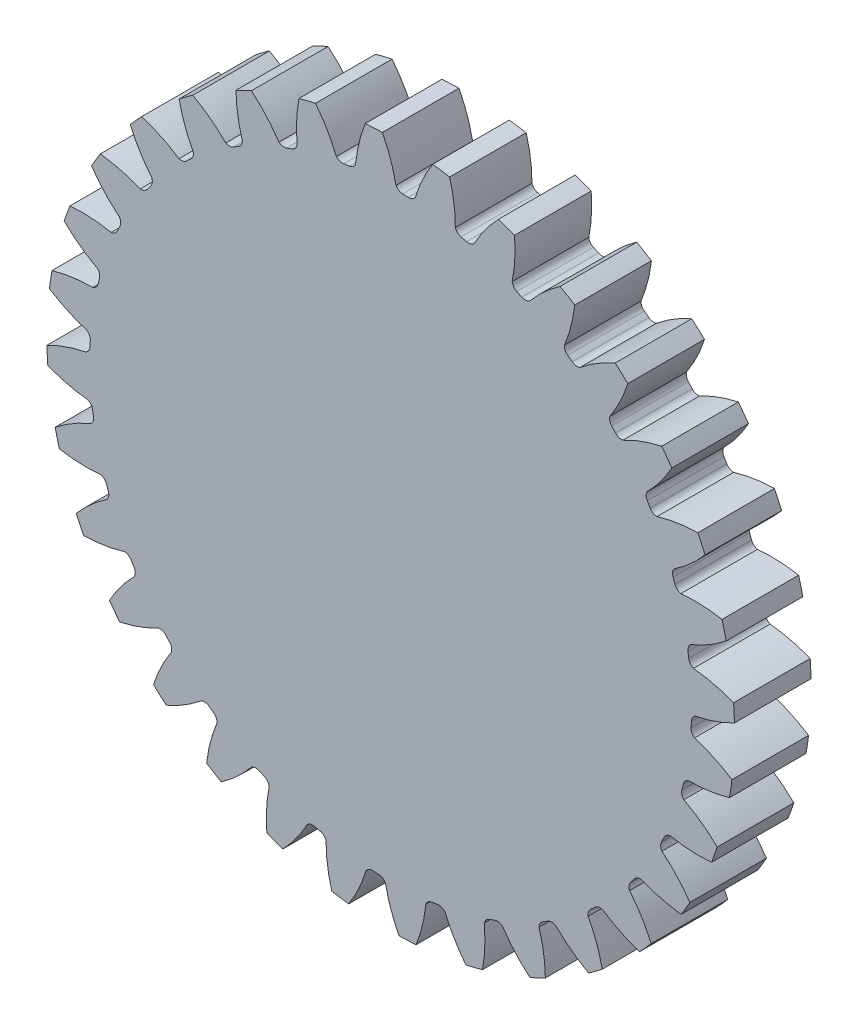
from build123d import *

# Parameters (mm, degrees)
SKETCH1_R                = 13.462
BOSS_EXTRUDE1_DEPTH      = 3
CUT_EXTRUDE1_DEPTH       = 20.2730612
FILLET1_R                = 0.311705625
CIRPATTERN1_COUNT        = 32
FILLET1_OF_CIRPATTERN1_R = 0.311705625


with BuildPart() as part:
    # Sketch1 → Boss-Extrude1 (new body)
    with BuildSketch(Plane.XY):
        Circle(SKETCH1_R)
    extrude(amount=-BOSS_EXTRUDE1_DEPTH)

    # Sketch4 → Cut-Extrude1 (cut, through all)
    with BuildSketch(Plane.XY):
        with BuildLine():
            Line((0.207454587, 11.93229302), (0.207454587, 11.779804646))
            ThreePointArc((0.207454587, 11.779804646), (0.578098596, 11.767439693), (0.948169824, 11.743415555))
            Line((0.948169824, 11.743415555), (0.963116334, 11.895169652))
            add(Edge.make_bspline(
                [(3.306374017, 15.066734335), (1.541843414, 13.803784653), (0.963116334, 11.895169652)],
                knots=[0, 0, 0, 1, 1, 1], degree=2))
            ThreePointArc((3.306374017, 15.066734335), (0.756883318, 15.406677783), (-1.813651192, 15.318265633))
            add(Edge.make_bspline(
                [(-1.813651192, 15.318265633), (-0.181408331, 13.888442781), (0.207454587, 11.93229302)],
                knots=[0, 0, 0, 1, 1, 1], degree=2))
        make_face()
    cut_extrude1 = extrude(amount=-CUT_EXTRUDE1_DEPTH, mode=Mode.SUBTRACT)

    # Fillet1
    # the kernel refuses this fillet: 0.311705625 mm, written as the material it adds along each edge
    with BuildSketch(Plane(origin=(0.948169824, 11.743415555, 0), x_dir=(0.09801736879934149, 0.995184704169861, 0), z_dir=(0, 0, -1))) as fillet1_piece_1:
        with BuildLine():
            CenterArc((0.304008317, -0.27240063), FILLET1_R, 119.084532855, 58.641413368)
            Line((-0.007451829, -0.260032367), (-0.013681032, -0.259785002))
            ThreePointArc((-0.013681032, -0.259785002), (-0.009239756, -0.129858172), (-0.006233146, 0.000109772))
            Line((-0.006233146, 0.000109772), (0, 0.006234113))
            ThreePointArc((0, 0.006234113), (0.076244187, 0.006234113), (0.149457975, 0.005448013))
            Line((0.149457975, 0.005448013), (0.152488373, 0))
        make_face()
    extrude(amount=3)
    with BuildSketch(Plane(origin=(0.207454587, 11.779804646, 0), x_dir=(0.9995896319554183, -0.028645552660602168, 0), z_dir=(0, 0, -1))) as fillet1_piece_2:
        with BuildLine():
            CenterArc((0.263580359, -0.311686629), FILLET1_R, 90.632559963, 58.641413368)
            Line((-0.004368114, -0.152425797), (-0.009727083, -0.14924058))
            ThreePointArc((-0.009727083, -0.14924058), (-0.008415611, -0.076034319), (-0.006231554, 0.00017858))
            Line((-0.006231554, 0.00017858), (6.8825e-05, 0.006233733))
            ThreePointArc((6.8825e-05, 0.006233733), (0.13006956, 0.005516105), (0.260070295, 0.006233733))
            Line((0.260070295, 0.006233733), (0.26013912, 0))
        make_face()
    extrude(amount=3)

    # CirPattern1: Cut-Extrude1 ×32 about axis
    cirpattern1_axis = Axis((0, 0, -3), (0, 0, 1))
    for i in range(1, CIRPATTERN1_COUNT):
        add(cut_extrude1.rotate(cirpattern1_axis, i * 360 / CIRPATTERN1_COUNT), mode=Mode.SUBTRACT)

    # Fillet1 of CirPattern1
    # the kernel refuses this fillet: 0.311705625 mm, written as the material it adds along each edge
    with BuildSketch(Plane(origin=(-1.361075715, 11.702747874, 0), x_dir=(-0.9919686085446638, -0.1264843059907568, 0), z_dir=(0, 0, -1)), Plane(origin=(-3.618015878, 11.212350156, 0), x_dir=(-0.948232345896958, -0.31757742078861934, 0), z_dir=(0, 0, -1)), Plane(origin=(-5.73591772, 10.291068109, 0), x_dir=(-0.8680560459712611, -0.49646621340504116, 0), z_dir=(0, 0, -1)), Plane(origin=(-7.633391461, 8.974306086, 0), x_dir=(-0.754520839010323, -0.6562760878617767, 0), z_dir=(0, 0, -1)), Plane(origin=(-9.237518248, 7.312666513, 0), x_dir=(-0.6119898193463794, -0.7908656403058524, 0), z_dir=(0, 0, -1)), Plane(origin=(-10.48665239, 5.370005266, 0), x_dir=(-0.44594037413280585, -0.8950626697155306, 0), z_dir=(0, 0, -1)), Plane(origin=(-11.332790362, 3.220977729, 0), x_dir=(-0.26275369042754343, -0.9648629426849735, 0), z_dir=(0, 0, -1)), Plane(origin=(-11.743415555, 0.948169824, 0), x_dir=(-0.06946952975312047, -0.9975840738684034, 0), z_dir=(0, 0, -1)), Plane(origin=(-11.702747874, -1.361075715, 0), x_dir=(0.1264843059907568, -0.9919686085446638, 0), z_dir=(0, 0, -1)), Plane(origin=(-11.212350156, -3.618015878, 0), x_dir=(0.31757742078862394, -0.9482323458969565, 0), z_dir=(0, 0, -1)), Plane(origin=(-10.291068109, -5.73591772, 0), x_dir=(0.49646621340504776, -0.8680560459712573, 0), z_dir=(0, 0, -1)), Plane(origin=(-8.974306086, -7.633391461, 0), x_dir=(0.6562760878617767, -0.754520839010323, 0), z_dir=(0, 0, -1)), Plane(origin=(-7.312666513, -9.237518248, 0), x_dir=(0.7908656403058557, -0.6119898193463752, 0), z_dir=(0, 0, -1)), Plane(origin=(-5.370005266, -10.48665239, 0), x_dir=(0.8950626697155298, -0.4459403741328072, 0), z_dir=(0, 0, -1)), Plane(origin=(-3.220977729, -11.332790362, 0), x_dir=(0.9648629426849732, -0.26275369042754426, 0), z_dir=(0, 0, -1)), Plane(origin=(-0.948169824, -11.743415555, 0), x_dir=(0.9975840738684034, -0.06946952975312047, 0), z_dir=(0, 0, -1)), Plane(origin=(1.361075715, -11.702747874, 0), x_dir=(0.9919686085446638, 0.12648430599075672, 0), z_dir=(0, 0, -1)), Plane(origin=(3.618015878, -11.212350156, 0), x_dir=(0.9482323458969549, 0.317577420788628, 0), z_dir=(0, 0, -1)), Plane(origin=(5.73591772, -10.291068109, 0), x_dir=(0.8680560459712532, 0.49646621340505515, 0), z_dir=(0, 0, -1)), Plane(origin=(7.633391461, -8.974306086, 0), x_dir=(0.754520839010323, 0.6562760878617767, 0), z_dir=(0, 0, -1)), Plane(origin=(9.237518248, -7.312666513, 0), x_dir=(0.6119898193463794, 0.7908656403058524, 0), z_dir=(0, 0, -1)), Plane(origin=(10.48665239, -5.370005266, 0), x_dir=(0.44594037413279225, 0.8950626697155375, 0), z_dir=(0, 0, -1)), Plane(origin=(11.332790362, -3.220977729, 0), x_dir=(0.26275369042753616, 0.9648629426849755, 0), z_dir=(0, 0, -1)), Plane(origin=(11.743415555, -0.948169824, 0), x_dir=(0.06946952975312044, 0.9975840738684034, 0), z_dir=(0, 0, -1)), Plane(origin=(11.702747874, 1.361075715, 0), x_dir=(-0.1264843059907569, 0.9919686085446638, 0), z_dir=(0, 0, -1)), Plane(origin=(11.212350156, 3.618015878, 0), x_dir=(-0.3175774207886224, 0.9482323458969569, 0), z_dir=(0, 0, -1)), Plane(origin=(10.291068109, 5.73591772, 0), x_dir=(-0.49646621340504776, 0.8680560459712573, 0), z_dir=(0, 0, -1)), Plane(origin=(8.974306086, 7.633391461, 0), x_dir=(-0.6562760878617767, 0.754520839010323, 0), z_dir=(0, 0, -1)), Plane(origin=(7.312666513, 9.237518248, 0), x_dir=(-0.7908656403058524, 0.6119898193463794, 0), z_dir=(0, 0, -1)), Plane(origin=(5.370005266, 10.48665239, 0), x_dir=(-0.895062669715538, 0.4459403741327908, 0), z_dir=(0, 0, -1)), Plane(origin=(3.220977729, 11.332790362, 0), x_dir=(-0.964862942684974, 0.26275369042754165, 0), z_dir=(0, 0, -1))) as fillet1_of_cirpattern1_piece_1:
        with BuildLine():
            CenterArc((0.263580359, 0.311686629), FILLET1_OF_CIRPATTERN1_R, 210.72602667, 58.641413368)
            Line((-0.004368114, 0.152425797), (-0.009727083, 0.14924058))
            ThreePointArc((-0.009727083, 0.14924058), (-0.008415611, 0.076034319), (-0.006231554, -0.00017858))
            Line((-0.006231554, -0.00017858), (6.8825e-05, -0.006233733))
            ThreePointArc((6.8825e-05, -0.006233733), (0.13006956, -0.005516105), (0.260070295, -0.006233733))
            Line((0.260070295, -0.006233733), (0.26013912, 0))
        make_face()
    extrude(amount=3)
    with BuildSketch(Plane(origin=(-2.094657476, 11.593931385, 0), x_dir=(-0.19509032201606008, 0.9807852804032441, 0), z_dir=(0, 0, -1)), Plane(origin=(-8.182887201, 8.476272292, 0), x_dir=(-0.7071067811864952, 0.7071067811866, 0), z_dir=(0, 0, -1)), Plane(origin=(-11.512986621, 2.501594287, 0), x_dir=(-0.9807852804032181, 0.19509032201619061, 0), z_dir=(0, 0, -1)), Plane(origin=(-11.779804646, 0.207454587, 0), x_dir=(-1, 0, 0), z_dir=(0, 0, -1)), Plane(origin=(-11.593931385, -2.094657476, 0), x_dir=(-0.9807852804032435, -0.1950903220160629, 0), z_dir=(0, 0, -1)), Plane(origin=(-8.476272292, -8.182887201, 0), x_dir=(-0.7071067811865941, -0.7071067811865009, 0), z_dir=(0, 0, -1)), Plane(origin=(-2.501594287, -11.512986621, 0), x_dir=(-0.195090322016199, -0.9807852804032163, 0), z_dir=(0, 0, -1)), Plane(origin=(-0.207454587, -11.779804646, 0), x_dir=(0, -1, 0), z_dir=(0, 0, -1)), Plane(origin=(2.094657476, -11.593931385, 0), x_dir=(0.1950903220160623, -0.9807852804032435, 0), z_dir=(0, 0, -1)), Plane(origin=(8.182887201, -8.476272292, 0), x_dir=(0.7071067811865009, -0.7071067811865941, 0), z_dir=(0, 0, -1)), Plane(origin=(11.512986621, -2.501594287, 0), x_dir=(0.9807852804032176, -0.19509032201619342, 0), z_dir=(0, 0, -1)), Plane(origin=(11.779804646, -0.207454587, 0), x_dir=(1, 0, 0), z_dir=(0, 0, -1)), Plane(origin=(11.593931385, 2.094657476, 0), x_dir=(0.980785280403245, 0.19509032201605506, 0), z_dir=(0, 0, -1)), Plane(origin=(8.476272292, 8.182887201, 0), x_dir=(0.7071067811865883, 0.7071067811865068, 0), z_dir=(0, 0, -1)), Plane(origin=(2.501594287, 11.512986621, 0), x_dir=(0.19509032201619061, 0.9807852804032181, 0), z_dir=(0, 0, -1))) as fillet1_of_cirpattern1_piece_2:
        with BuildLine():
            CenterArc((0.304008317, 0.27240063), FILLET1_OF_CIRPATTERN1_R, 182.274053777, 58.641413368)
            Line((-0.007451829, 0.260032367), (-0.013681032, 0.259785002))
            ThreePointArc((-0.013681032, 0.259785002), (-0.009239756, 0.129858172), (-0.006233146, -0.000109772))
            Line((-0.006233146, -0.000109772), (0, -0.006234112))
            ThreePointArc((0, -0.006234112), (0.076244187, -0.006234113), (0.149457975, -0.005448013))
            Line((0.149457975, -0.005448013), (0.152488373, 0))
        make_face()
    extrude(amount=3)
    with BuildSketch(Plane(origin=(-4.316273028, 10.962509843, 0), x_dir=(-0.3826834323650338, 0.9238795325113098, 0), z_dir=(0, 0, -1)), Plane(origin=(-6.372016627, 9.909805196, 0), x_dir=(-0.5555702330195518, 0.831469612302579, 0), z_dir=(0, 0, -1)), Plane(origin=(-9.679294009, 6.717000997, 0), x_dir=(-0.8314696123025126, 0.5555702330196511, 0), z_dir=(0, 0, -1)), Plane(origin=(-10.803730976, 4.699599122, 0), x_dir=(-0.9238795325112599, 0.3826834323651548, 0), z_dir=(0, 0, -1)), Plane(origin=(-10.962509843, -4.316273028, 0), x_dir=(-0.9238795325113158, -0.38268343236501984, 0), z_dir=(0, 0, -1)), Plane(origin=(-9.909805196, -6.372016627, 0), x_dir=(-0.831469612302579, -0.5555702330195518, 0), z_dir=(0, 0, -1)), Plane(origin=(-6.717000997, -9.679294009, 0), x_dir=(-0.5555702330196551, -0.8314696123025098, 0), z_dir=(0, 0, -1)), Plane(origin=(-4.699599122, -10.803730976, 0), x_dir=(-0.3826834323651498, -0.9238795325112619, 0), z_dir=(0, 0, -1)), Plane(origin=(4.316273028, -10.962509843, 0), x_dir=(0.3826834323650248, -0.9238795325113136, 0), z_dir=(0, 0, -1)), Plane(origin=(6.372016627, -9.909805196, 0), x_dir=(0.5555702330195463, -0.8314696123025824, 0), z_dir=(0, 0, -1)), Plane(origin=(9.679294009, -6.717000997, 0), x_dir=(0.8314696123025035, -0.5555702330196646, 0), z_dir=(0, 0, -1)), Plane(origin=(10.803730976, -4.699599122, 0), x_dir=(0.9238795325112616, -0.3826834323651507, 0), z_dir=(0, 0, -1)), Plane(origin=(10.962509843, 4.316273028, 0), x_dir=(0.9238795325113078, 0.3826834323650388, 0), z_dir=(0, 0, -1)), Plane(origin=(9.909805196, 6.372016627, 0), x_dir=(0.8314696123025852, 0.5555702330195423, 0), z_dir=(0, 0, -1)), Plane(origin=(6.717000997, 9.679294009, 0), x_dir=(0.5555702330196647, 0.8314696123025036, 0), z_dir=(0, 0, -1)), Plane(origin=(4.699599122, 10.803730976, 0), x_dir=(0.3826834323651457, 0.9238795325112636, 0), z_dir=(0, 0, -1))) as fillet1_of_cirpattern1_piece_3:
        with BuildLine():
            CenterArc((0.304008317, 0.27240063), FILLET1_OF_CIRPATTERN1_R, 182.274053777, 58.641413368)
            Line((-0.007451829, 0.260032367), (-0.013681032, 0.259785002))
            ThreePointArc((-0.013681032, 0.259785002), (-0.009239756, 0.129858172), (-0.006233146, -0.000109772))
            Line((-0.006233146, -0.000109772), (0, -0.006234113))
            ThreePointArc((0, -0.006234113), (0.076244187, -0.006234113), (0.149457975, -0.005448013))
            Line((0.149457975, -0.005448013), (0.152488373, 0))
        make_face()
    extrude(amount=3)


solid = part.part
